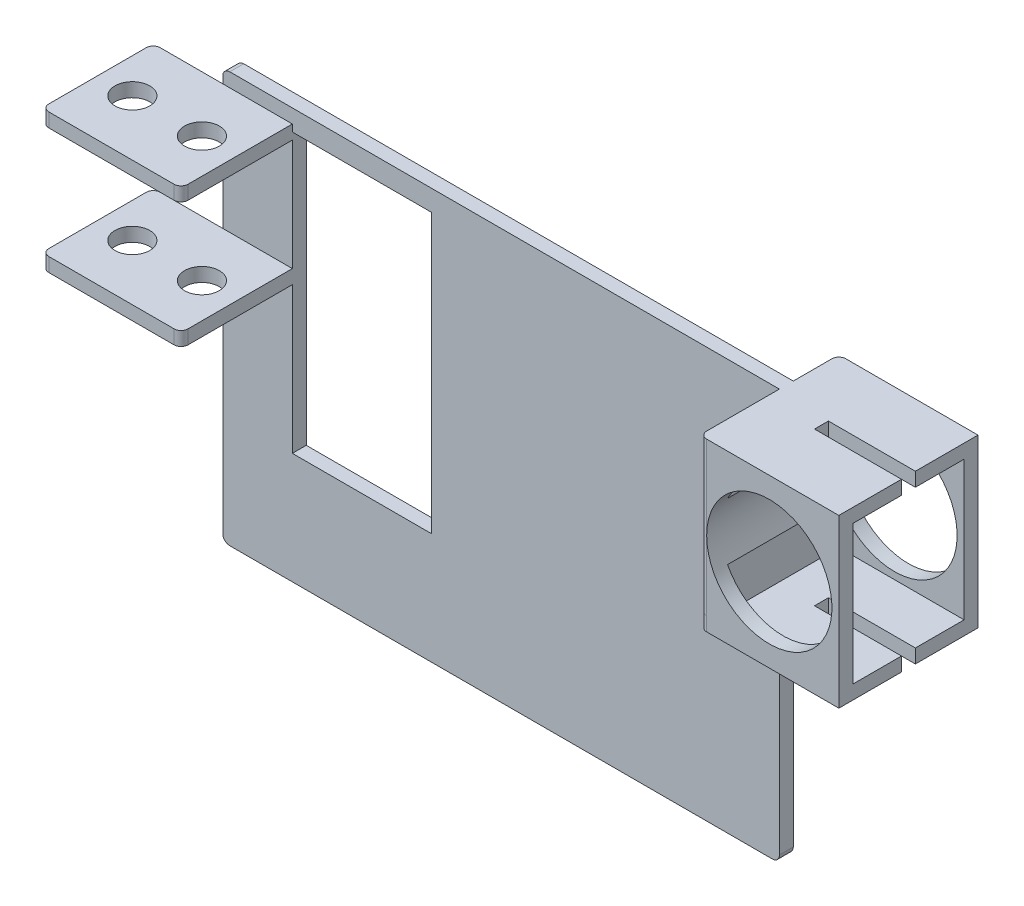
from build123d import *

# Parameters (mm, degrees)
BOSS_EXTRUDE1_DEPTH = 20
FILLET1_R           = 1
SKETCH2_R           = 9
CUT_EXTRUDE1_DEPTH  = 20
BOSS_EXTRUDE2_START = 2
BOSS_EXTRUDE2_DEPTH = 2
SKETCH4_W           = 20
SKETCH4_H           = 20
BOSS_EXTRUDE3_DEPTH = 2
FILLET2_R           = 1
SKETCH5_W           = 12.5
SKETCH5_H           = 2
CUT_EXTRUDE2_DEPTH  = 24
BOSS_EXTRUDE4_DEPTH = 80
FILLET3_R           = 1
SKETCH8_R           = 7.11392485
SKETCH8_W           = 20
SKETCH8_H           = 40
CUT_EXTRUDE3_DEPTH  = 2
SKETCH9_W           = 20
SKETCH9_H           = 2
BOSS_EXTRUDE5_DEPTH = 16
FILLET4_R           = 1
SKETCH10_R          = 2.5
CUT_EXTRUDE4_DEPTH  = 20


with BuildPart() as part:
    # Sketch1 → Boss-Extrude1 (new body)
    with BuildSketch(Plane(origin=(0, 0, 0), x_dir=(1, 0, 0), z_dir=(0, 1, 0))):
        Polygon((-2.291666667, 11.041666667), (-22.291666667, 11.041666667), (-22.291666667, -8.958333333), (-2.291666667, -8.958333333), (-2.291666667, -6.958333333), (-20.291666667, -6.958333333), (-20.291666667, 9.041666667), (-2.291666667, 9.041666667), align=None)
    extrude(amount=BOSS_EXTRUDE1_DEPTH)

    # Fillet1
    fillet1_edges = [part.edges().sort_by_distance(p)[0] for p in [
        (-22.291666667, 10, 8.958333333),
        (-22.291666667, 10, -11.041666667),
    ]]
    fillet(fillet1_edges, radius=FILLET1_R)

    # Sketch2 → Cut-Extrude1 (cut)
    with BuildSketch(Plane.XY.offset(8.958333333)):
        with Locations(Location((-12.291666667, 10, 0), (0, 0, 180))):
            Circle(SKETCH2_R)
    extrude(amount=-CUT_EXTRUDE1_DEPTH, mode=Mode.SUBTRACT)

    # Sketch3 → Boss-Extrude2 (add)
    with BuildSketch(Plane(origin=(0, 20, 0), x_dir=(1, 0, 0), z_dir=(0, 1, 0)).offset(BOSS_EXTRUDE2_START)):
        Polygon((-2.291666667, 2.377848536), (-2.291666667, 9.041666667), (-20.291666667, 9.041666667), (-20.291666667, -6.958333333), (-2.291666667, -6.958333333), (-2.291666667, 0.377848536), align=None)
        with BuildLine():
            Line((-2.291666667, 9.041666667), (-2.291666667, 11.041666667))
            Line((-2.291666667, 11.041666667), (-21.291666667, 11.041666667))
            ThreePointArc((-21.291666667, 11.041666667), (-21.998773448, 10.748773448), (-22.291666667, 10.041666667))
            Line((-22.291666667, 10.041666667), (-22.291666667, -7.958333333))
            ThreePointArc((-22.291666667, -7.958333333), (-21.998773448, -8.665440115), (-21.291666667, -8.958333333))
            Line((-21.291666667, -8.958333333), (-2.291666667, -8.958333333))
            Line((-2.291666667, -8.958333333), (-2.291666667, -6.958333333))
            Line((-2.291666667, -6.958333333), (-20.291666667, -6.958333333))
            Line((-20.291666667, -6.958333333), (-20.291666667, 9.041666667))
            Line((-20.291666667, 9.041666667), (-2.291666667, 9.041666667))
        make_face()
    extrude(amount=-BOSS_EXTRUDE2_DEPTH)

    # Sketch4 → Boss-Extrude3 (add)
    with BuildSketch(Plane.XZ):
        with Locations((-12.291666667, -1.041666667)):
            Rectangle(SKETCH4_W, SKETCH4_H)
    extrude(amount=BOSS_EXTRUDE3_DEPTH)

    # Fillet2
    fillet2_edges = [part.edges().sort_by_distance(p)[0] for p in [
        (-22.291666667, -1, -11.041666667),
        (-22.291666667, -1, 8.958333333),
    ]]
    fillet(fillet2_edges, radius=FILLET2_R - 0.0001)  # a hair under: the kernel refuses the full size

    # Sketch5 → Cut-Extrude2 (cut)
    with BuildSketch(Plane(origin=(0, 22, 0), x_dir=(1, 0, 0), z_dir=(0, 1, 0))):
        with Locations((-8.541666667, 1.041666667)):
            Rectangle(SKETCH5_W, SKETCH5_H)
    extrude(amount=-CUT_EXTRUDE2_DEPTH, mode=Mode.SUBTRACT)

    # Sketch6 → Boss-Extrude4 (add)
    with BuildSketch(Plane.ZY.offset(22.291666667)):
        Polygon((-2.491666667, -37), (-4.491666667, -37), (-4.491666667, -2), (-4.491666667, 22), (-2.491666667, 22), (-2.491666667, -2), align=None)
    extrude(amount=BOSS_EXTRUDE4_DEPTH)

    # Fillet3
    fillet3_edges = [part.edges().sort_by_distance(p)[0] for p in [
        (-22.291666667, -37, -3.491666667),
        (-102.291666667, 22, -3.491666667),
        (-102.291666667, -37, -3.491666667),
    ]]
    fillet(fillet3_edges, radius=FILLET3_R)

    # Sketch8 → Cut-Extrude3 (cut)
    with BuildSketch(Plane(origin=(0, 0, -4.491666667), x_dir=(-1, 0, 0), z_dir=(0, 0, -1))):
        with Locations((12.291666667, 10)):
            Circle(SKETCH8_R)
        with Locations((82.291666667, -1)):
            Rectangle(SKETCH8_W, SKETCH8_H)
    extrude(amount=-CUT_EXTRUDE3_DEPTH, mode=Mode.SUBTRACT)

    # Sketch9 → Boss-Extrude5 (add)
    with BuildSketch(Plane.XY.offset(-2.491666667)):
        Polygon((-92.823958121, 20), (-112.291666667, 20), (-112.291666667, 18), (-92.291666667, 18), (-92.291666667, 20), align=None)
        with Locations((-102.291666667, 1)):
            Rectangle(SKETCH9_W, SKETCH9_H)
    extrude(amount=BOSS_EXTRUDE5_DEPTH)

    # Fillet4
    fillet4_edges = [part.edges().sort_by_distance(p)[0] for p in [
        (-112.291666667, 19, -2.491666667),
        (-112.291666667, 19, 13.508333333),
        (-92.291666667, 19, 13.508333333),
        (-112.291666667, 1, -2.491666667),
        (-92.291666667, 1, 13.508333333),
        (-112.291666667, 1, 13.508333333),
    ]]
    fillet(fillet4_edges, radius=FILLET4_R)

    # Sketch10 → Cut-Extrude4 (cut)
    with BuildSketch(Plane(origin=(0, 20, 0), x_dir=(1, 0, 0), z_dir=(0, 1, 0))):
        with Locations(Location((-97.291666667, -5.508333333, 0), (0, 0, 180))):
            Circle(SKETCH10_R)
        with Locations(Location((-107.291666667, -5.508333333, 0), (0, 0, 180))):
            Circle(SKETCH10_R)
    extrude(amount=-CUT_EXTRUDE4_DEPTH, mode=Mode.SUBTRACT)


solid = part.part
